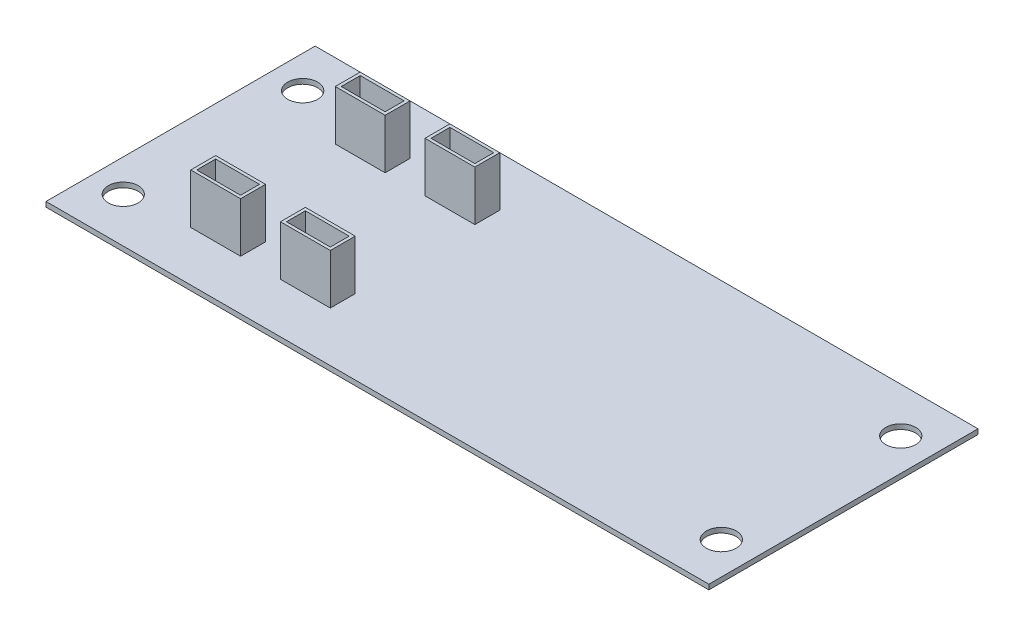
from build123d import *

# Parameters (mm, degrees)
SKETCH1_W           = 66.5
SKETCH1_H           = 27
SKETCH1_R           = 1.5
BOSS_EXTRUDE1_DEPTH = 0.5
SKETCH2_W           = 5
SKETCH2_H           = 2.5
SKETCH2_W_2         = 4.4
SKETCH2_H_2         = 1.9
BOSS_EXTRUDE2_DEPTH = 5


with BuildPart() as part:
    # Sketch1 → Boss-Extrude1 (new body)
    with BuildSketch(Plane(origin=(0, 0, 0), x_dir=(1, 0, 0), z_dir=(0, 1, 0))):
        Rectangle(SKETCH1_W, SKETCH1_H)
        with Locations((-30, 9)):
            Circle(SKETCH1_R, mode=Mode.SUBTRACT)
        with Locations((-30, -9)):
            Circle(SKETCH1_R, mode=Mode.SUBTRACT)
        with Locations((30, 9)):
            Circle(SKETCH1_R, mode=Mode.SUBTRACT)
        with Locations((30, -9)):
            Circle(SKETCH1_R, mode=Mode.SUBTRACT)
    extrude(amount=BOSS_EXTRUDE1_DEPTH)

    # Sketch2 → Boss-Extrude2 (add)
    # profile 1 of 4: a face of its own
    with BuildSketch(Plane(origin=(0, 0.5, 0), x_dir=(1, 0, 0), z_dir=(0, 1, 0))):
        with Locations((-21.228920611, 7.25)):
            Rectangle(SKETCH2_W, SKETCH2_H)
        with Locations((-21.228920611, 7.25)):
            Rectangle(SKETCH2_W_2, SKETCH2_H_2, mode=Mode.SUBTRACT)
    # profile 2 of 4: a face of its own
    with BuildSketch(Plane(origin=(0, 0.5, 0), x_dir=(1, 0, 0), z_dir=(0, 1, 0))):
        with Locations((-12.228920611, 7.25)):
            Rectangle(SKETCH2_W, SKETCH2_H)
        with Locations((-12.228920611, 7.25)):
            Rectangle(SKETCH2_W_2, SKETCH2_H_2, mode=Mode.SUBTRACT)
    # profile 3 of 4: a face of its own
    with BuildSketch(Plane(origin=(0, 0.5, 0), x_dir=(1, 0, 0), z_dir=(0, 1, 0))):
        with Locations((-12.228920611, -7.25)):
            Rectangle(SKETCH2_W, SKETCH2_H)
        with Locations((-12.228920611, -7.25)):
            Rectangle(SKETCH2_W_2, SKETCH2_H_2, mode=Mode.SUBTRACT)
    # profile 4 of 4: a face of its own
    with BuildSketch(Plane(origin=(0, 0.5, 0), x_dir=(1, 0, 0), z_dir=(0, 1, 0))):
        with Locations((-21.228920611, -7.25)):
            Rectangle(SKETCH2_W, SKETCH2_H)
        with Locations((-21.228920611, -7.25)):
            Rectangle(SKETCH2_W_2, SKETCH2_H_2, mode=Mode.SUBTRACT)
    extrude(amount=BOSS_EXTRUDE2_DEPTH)


solid = part.part
